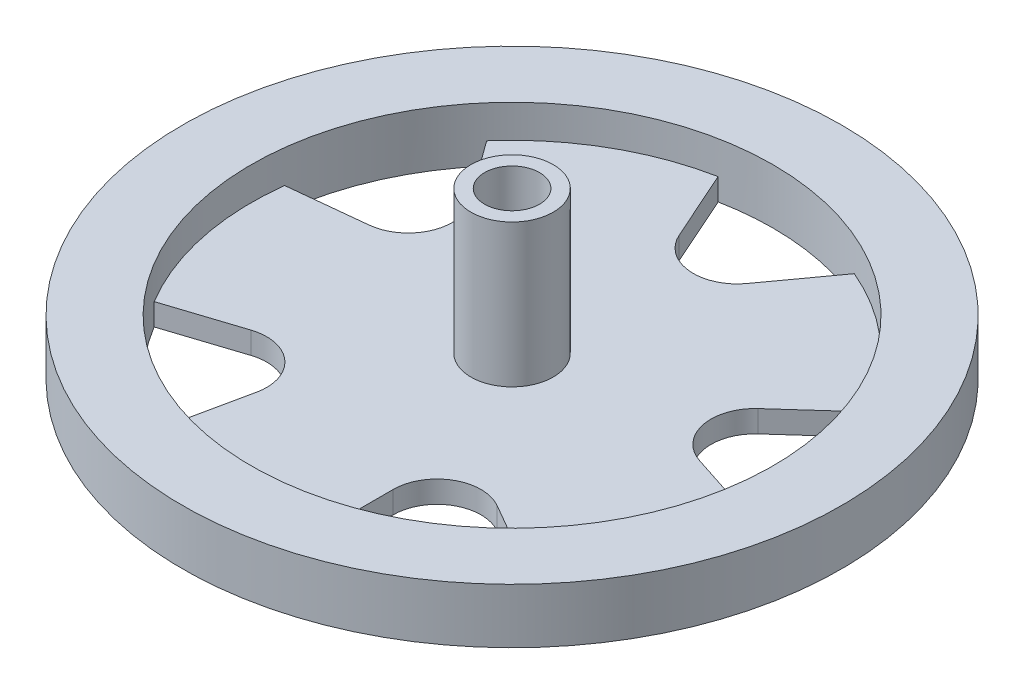
from build123d import *

# Parameters (mm, degrees)
CUT_EXTRUDE1_DEPTH = 58.15
CIRPATTERN1_COUNT  = 5


with BuildPart() as part:
    # Sketch1 → Revolve1 (revolve)
    with BuildSketch(Plane.XY):
        Polygon((38.1, 6.35), (38.1, 0), (0, 0), (0, 6.35), (3.175, 6.35), (3.175, 19.05), (4.7625, 19.05), (4.7625, 2.54), (30.1625, 2.54), (30.1625, 6.35), align=None)
    revolve(axis=Axis((0, 0, 0), (0, 1, 0)))

    # Sketch2 → Cut-Extrude1 (cut, through all)
    with BuildSketch(Plane.XZ):
        with BuildLine():
            Line((6.758846, 29.395483), (6.758846, 20.505483))
            ThreePointArc((6.758846, 20.505483), (9.298846, 16.106074), (14.378846, 16.106074))
            Line((14.378846, 16.106074), (22.077812, 20.551074))
            ThreePointArc((22.077812, 20.551074), (15.08125, 26.121491), (6.758846, 29.395483))
        make_face()
    cut_extrude1 = extrude(amount=-CUT_EXTRUDE1_DEPTH, mode=Mode.SUBTRACT)

    # CirPattern1: Cut-Extrude1 ×5 about axis
    cirpattern1_axis = Axis((0, -1.42875, 0), (0, 1, 0))
    for i in range(1, CIRPATTERN1_COUNT):
        add(cut_extrude1.rotate(cirpattern1_axis, i * 360 / CIRPATTERN1_COUNT), mode=Mode.SUBTRACT)


solid = part.part
